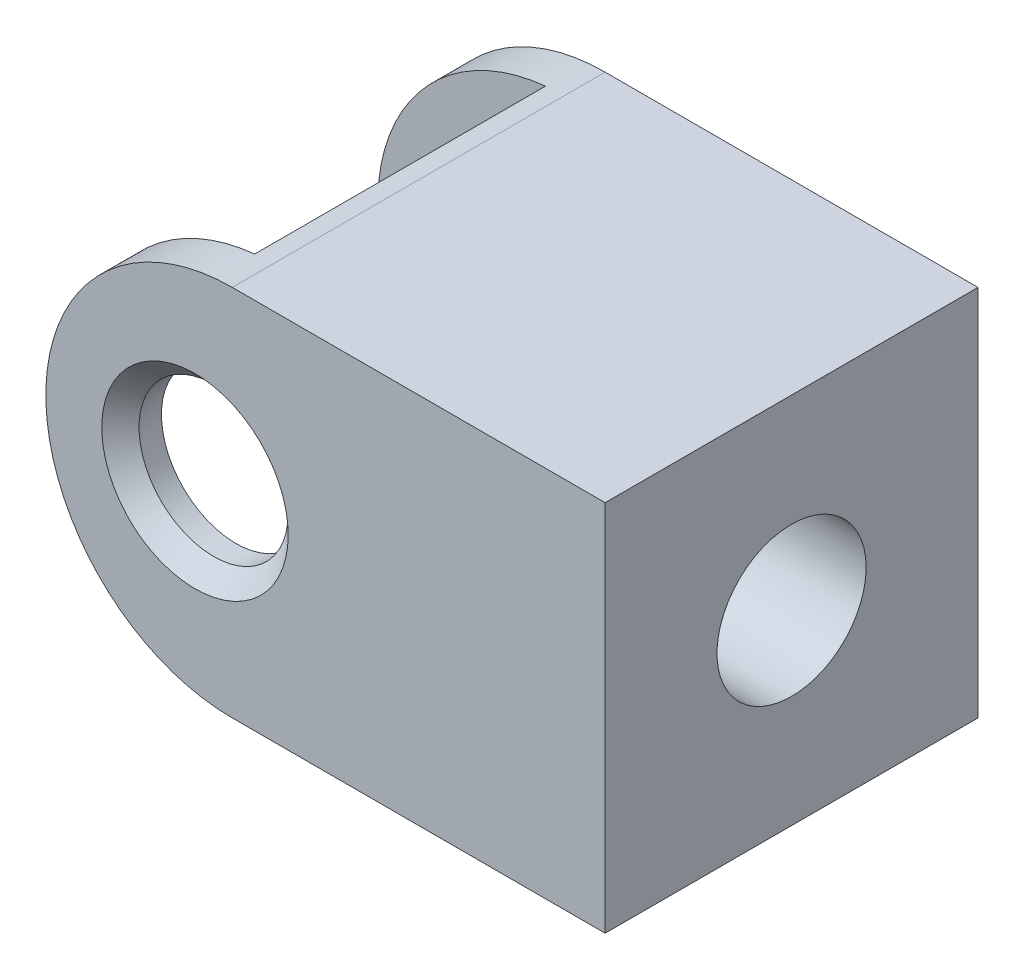
from build123d import *

# Parameters (mm, degrees)
Y_KSEKLIK_EKSTR_ZYON1_DEPTH = 20
KES_EKSTR_ZYON1_DEPTH       = 7.8
KES_EKSTR_ZYON1_DEPTH_BACK  = 7.8
IZIM2_R                     = 10
IZIM3_R                     = 4
KES_EKSTR_ZYON2_DEPTH       = 35.8
IZIM4_R                     = 4
KES_EKSTR_ZYON3_DEPTH       = 8
PAH1_SIZE                   = 1


with BuildPart() as part:
    # Çizim1 → Yükseklik-Ekstrüzyon1 (new body)
    with BuildSketch(Plane.XY):
        with BuildLine():
            Line((0, 10), (20, 10))
            Line((20, 10), (20, -10))
            Line((20, -10), (0, -10))
            ThreePointArc((0, -10), (-10, 0), (0, 10))
        make_face()
    extrude(amount=Y_KSEKLIK_EKSTR_ZYON1_DEPTH)

    # Çizim2 → Kes-Ekstrüzyon1 (cut, two sides: drawn at the far end of the back side and taken through both)
    with BuildSketch(Plane.XY.offset(10).offset(-KES_EKSTR_ZYON1_DEPTH_BACK)):
        with Locations((-2, 0)):
            Circle(IZIM2_R)
    extrude(amount=KES_EKSTR_ZYON1_DEPTH + KES_EKSTR_ZYON1_DEPTH_BACK, mode=Mode.SUBTRACT)

    # Çizim3 → Kes-Ekstrüzyon2 (cut)
    with BuildSketch(Plane.XY.offset(20)):
        with Locations((-2, 0)):
            Circle(IZIM3_R)
    extrude(amount=-KES_EKSTR_ZYON2_DEPTH, mode=Mode.SUBTRACT)

    # Çizim4 → Kes-Ekstrüzyon3 (cut)
    with BuildSketch(Plane(origin=(20, 0, 0), x_dir=(0, 0, -1), z_dir=(1, 0, 0))):
        with Locations((-10, 0)):
            Circle(IZIM4_R)
    extrude(amount=-KES_EKSTR_ZYON3_DEPTH, mode=Mode.SUBTRACT)

    # Pah1
    pah1_edges = [part.edges().sort_by_distance(p)[0] for p in [
        (-6, 0, 20),
        (-6, 0, 0),
    ]]
    chamfer(pah1_edges, length=PAH1_SIZE)


solid = part.part
